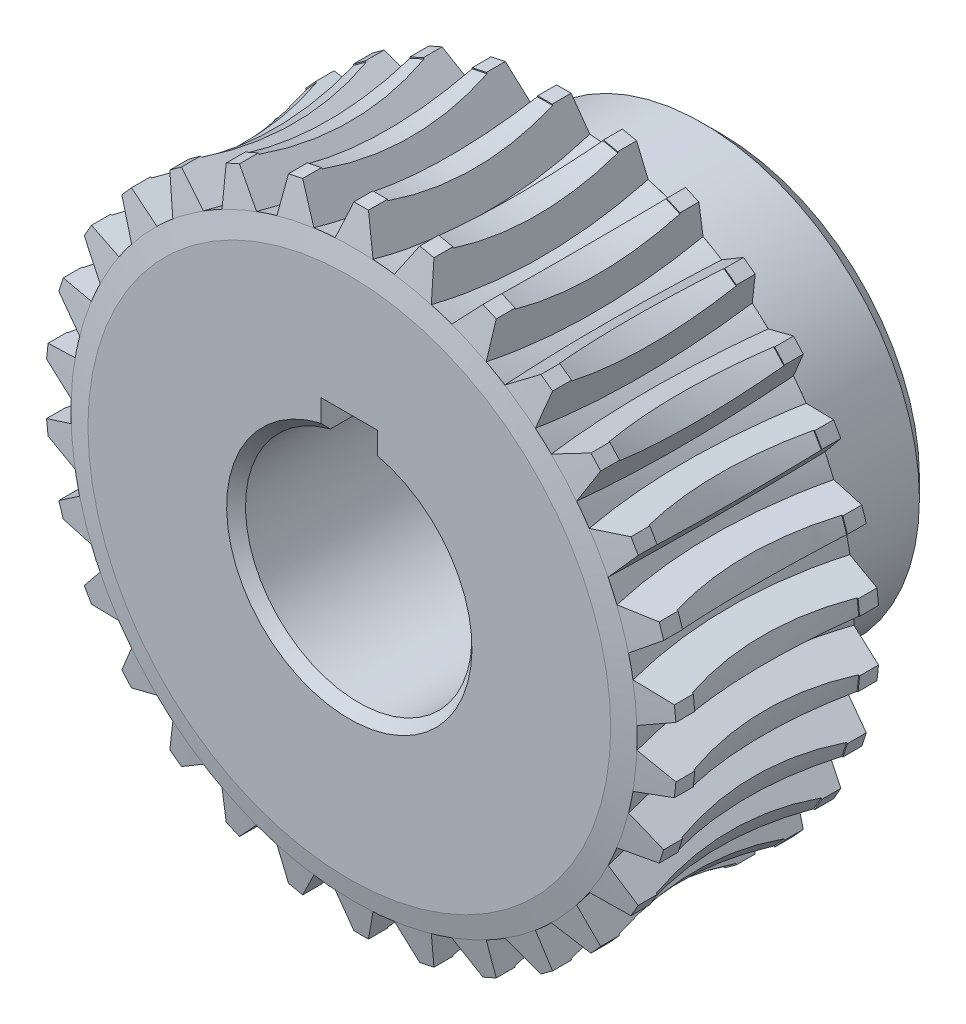
from build123d import *

# Parameters (mm, degrees)
SKETCH1_R               = 15
BOSS_EXTRUDE1_DEPTH     = 12
BOSS_EXTRUDE2_DEPTH     = 11.5
CIRPATTERN1_COUNT       = 30
SKETCH9_R               = 11.5
BOSS_EXTRUDE3_DEPTH     = 7.71
CUT_EXTRUDE2_DEPTH      = 31.760679569
CUT_EXTRUDE2_DEPTH_BACK = 31.760679569
SKETCH10_R              = 6
CUT_EXTRUDE3_DEPTH      = 31.760679569
CUT_EXTRUDE3_DEPTH_BACK = 31.760679569
SKETCH11_W              = 3
SKETCH11_H              = 6.631241372
CHAMFER1_SIZE           = 1
CHAMFER2_SIZE           = 0.5


with BuildPart() as part:
    # Sketch1 → Boss-Extrude1 (new body)
    with BuildSketch(Plane.XY):
        Circle(SKETCH1_R)
    extrude(amount=BOSS_EXTRUDE1_DEPTH)

    # Sketch2 → Cut-Revolve1 (revolve, cut)
    with BuildSketch(Plane(origin=(0, 0, 0), x_dir=(0, 0, -1), z_dir=(1, 0, 0))):
        Polygon((0, 13.85), (0, 15), (-0.25, 15), align=None)
        Polygon((-12, 15), (-12, 13.85), (-11.75, 15), align=None)
    revolve(axis=Axis((0, 0, 12), (0, 0, -1)), mode=Mode.SUBTRACT)

    # Sketch3 → Cut-Revolve2 (revolve, cut)
    with BuildSketch(Plane(origin=(0, 0, 0), x_dir=(0, 0, -1), z_dir=(1, 0, 0))):
        with BuildLine():
            Line((-0.25, 15), (-11.75, 15))
            ThreePointArc((-11.75, 15), (-6, 14.399305142), (-0.25, 15))
        make_face()
    revolve(axis=Axis((0, 0, 12), (0, 0, -1)), mode=Mode.SUBTRACT)

    # Sketch6 → Boss-Extrude2 (add)
    with BuildSketch(Plane(origin=(0, 0, 0.25), x_dir=(-1, 0, 0), z_dir=(0, 0, -1))):
        Polygon((-0.385, 16.725), (0.385, 16.725), (1, 14.966629547), (1.321168375, 14.048364537), (-1.321168375, 14.048364537), (-1, 14.966629547), align=None)
    boss_extrude2 = extrude(amount=-BOSS_EXTRUDE2_DEPTH)

    # CirPattern1: Boss-Extrude2 ×30 about axis
    cirpattern1_axis = Axis((0, 0, 0.25), (0, 0, 1))
    for i in range(1, CIRPATTERN1_COUNT):
        add(boss_extrude2.rotate(cirpattern1_axis, i * 360 / CIRPATTERN1_COUNT))

    # Sketch7 → Cut-Revolve3 (revolve, cut)
    with BuildSketch(Plane(origin=(0, 0, 0), x_dir=(0, 0, -1), z_dir=(1, 0, 0))):
        Polygon((-11.75, 17.220743027), (-11.75, 14.970316868), (-11.260776922, 17.220743027), align=None)
        Polygon((-0.25, 14.970316868), (-0.25, 17.220743027), (-0.739223078, 17.220743027), align=None)
    revolve(axis=Axis((0, 0, 0), (0, 0, 1)), mode=Mode.SUBTRACT)

    # Sketch8 → Cut-Revolve4 (revolve, cut)
    with BuildSketch(Plane(origin=(0, 0, 0), x_dir=(1, 0, 0), z_dir=(0, 1, 0))):
        with BuildLine():
            ThreePointArc((-16.673622158, -10.36758396), (-16.075746882, -6), (-16.673622158, -1.63241604))
            Line((-16.673622158, -1.63241604), (-16.863534515, -1.63241604))
            Line((-16.863534515, -1.63241604), (-16.863534515, -10.36758396))
            Line((-16.863534515, -10.36758396), (-16.673622158, -10.36758396))
        make_face()
    revolve(axis=Axis((0, 0, 0), (0, 0, 1)), mode=Mode.SUBTRACT)

    # Sketch9 → Boss-Extrude3 (add)
    with BuildSketch(Plane(origin=(0, 0, 0), x_dir=(-1, 0, 0), z_dir=(0, 0, -1))):
        Circle(SKETCH9_R)
    extrude(amount=BOSS_EXTRUDE3_DEPTH)

    # Sketch10 → Cut-Extrude2 (cut, two sides: drawn at the far end of the back side and taken through both)
    with BuildSketch(Plane(origin=(0, 0, -7.71), x_dir=(-1, 0, 0), z_dir=(0, 0, -1)).offset(-CUT_EXTRUDE2_DEPTH_BACK)):
        Circle(SKETCH10_R)
    extrude(amount=CUT_EXTRUDE2_DEPTH + CUT_EXTRUDE2_DEPTH_BACK, mode=Mode.SUBTRACT)

    # Sketch11 → Cut-Extrude3 (cut, two sides: drawn at the far end of the back side and taken through both)
    with BuildSketch(Plane(origin=(0, 0, -7.71), x_dir=(-1, 0, 0), z_dir=(0, 0, -1)).offset(-CUT_EXTRUDE3_DEPTH_BACK)):
        with Locations((0, 4.184379314)):
            Rectangle(SKETCH11_W, SKETCH11_H)
    extrude(amount=CUT_EXTRUDE3_DEPTH + CUT_EXTRUDE3_DEPTH_BACK, mode=Mode.SUBTRACT)

    # Chamfer1
    chamfer1_edges = [part.edges().sort_by_distance(p)[0] for p in [
        (11.5, 0, -7.71),
    ]]
    chamfer(chamfer1_edges, length=CHAMFER1_SIZE)

    # Chamfer2
    chamfer2_edges = [part.edges().sort_by_distance(p)[0] for p in [
        (0, -6, 12),
        (0, -6, -7.71),
    ]]
    chamfer(chamfer2_edges, length=CHAMFER2_SIZE)


solid = part.part
